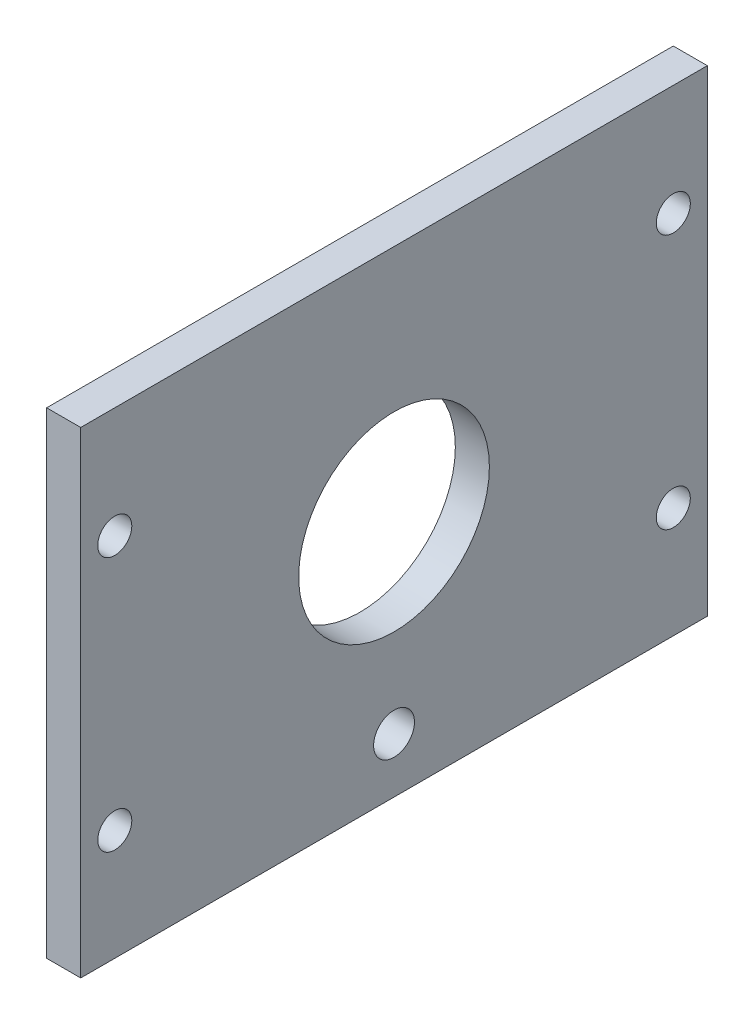
from build123d import *

# Parameters (mm, degrees)
SKETCH1_W               = 92
SKETCH1_H               = 70
SKETCH1_R               = 14
BOSS_EXTRUDE1_DEPTH     = 5
CUT_EXTRUDE1_DEPTH      = 116.71084651
CUT_EXTRUDE1_DEPTH_BACK = 116.71084651
SKETCH2_R               = 2.5
CUT_EXTRUDE2_DEPTH      = 116.71084651
CUT_EXTRUDE2_DEPTH_BACK = 116.71084651
SKETCH3_R               = 3


with BuildPart() as part:
    # Sketch1 → Boss-Extrude1 (new body)
    with BuildSketch(Plane(origin=(0, 0, 0), x_dir=(0, 0, -1), z_dir=(1, 0, 0))):
        with Locations((46, -35)):
            Rectangle(SKETCH1_W, SKETCH1_H)
        with Locations((46, -35)):
            Circle(SKETCH1_R, mode=Mode.SUBTRACT)
    extrude(amount=BOSS_EXTRUDE1_DEPTH)

    # Sketch2 → Cut-Extrude1 (cut, two sides: drawn at the far end of the back side and taken through both)
    with BuildSketch(Plane(origin=(5, 0, 0), x_dir=(0, 0, -1), z_dir=(1, 0, 0)).offset(-CUT_EXTRUDE1_DEPTH_BACK)):
        with Locations((5, -16.272445859)):
            Circle(SKETCH2_R)
        with Locations((5, -53.727554141)):
            Circle(SKETCH2_R)
        with Locations((87, -53.727554141)):
            Circle(SKETCH2_R)
        with Locations((87, -16.272445859)):
            Circle(SKETCH2_R)
    extrude(amount=CUT_EXTRUDE1_DEPTH + CUT_EXTRUDE1_DEPTH_BACK, mode=Mode.SUBTRACT)

    # Sketch3 → Cut-Extrude2 (cut, two sides: drawn at the far end of the back side and taken through both)
    with BuildSketch(Plane(origin=(5, 0, 0), x_dir=(0, 0, -1), z_dir=(1, 0, 0)).offset(-CUT_EXTRUDE2_DEPTH_BACK)):
        with Locations((46, -61.940521943)):
            Circle(SKETCH3_R)
    extrude(amount=CUT_EXTRUDE2_DEPTH + CUT_EXTRUDE2_DEPTH_BACK, mode=Mode.SUBTRACT)


solid = part.part
